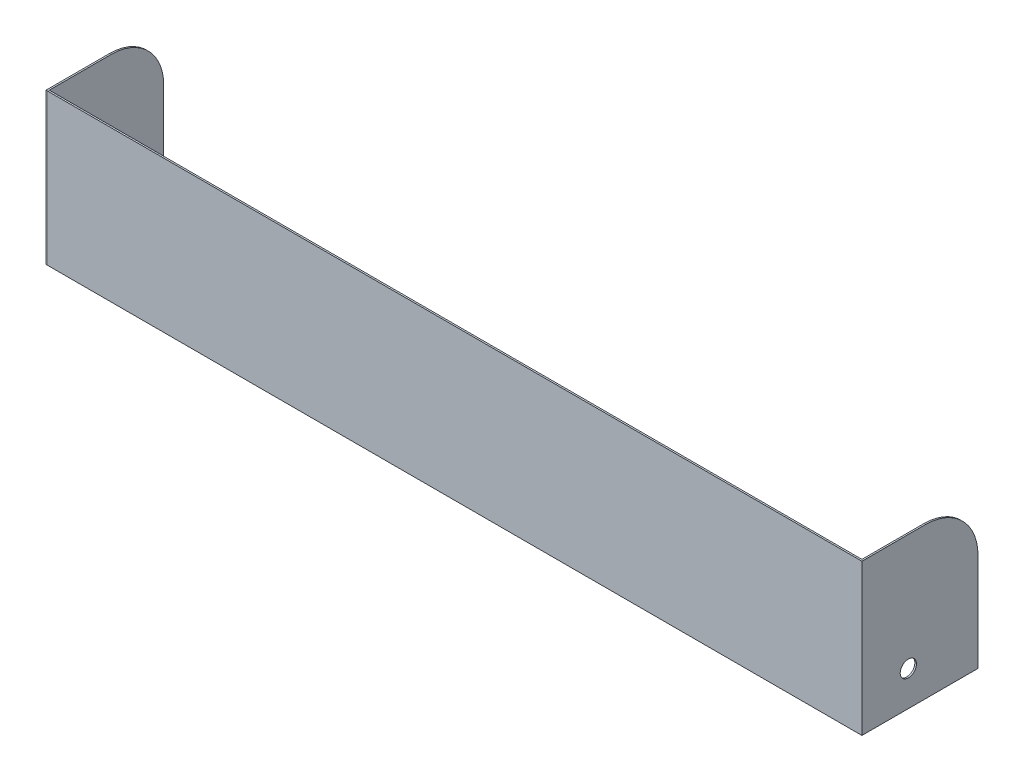
from build123d import *

# Parameters (mm, degrees)
SKETCH1_W               = 350
SKETCH1_H               = 65
BACK_WALL_DEPTH         = 0.7
RIGHT_WALL_DEPTH        = 0.7
CUT_EXTRUDE1_DEPTH      = 356.63637328
CUT_EXTRUDE1_DEPTH_BACK = 356.63637328
SKETCH6_R               = 3.5


with BuildPart() as part:
    # Sketch1 → Back Wall (new body)
    with BuildSketch(Plane.XY):
        Rectangle(SKETCH1_W, SKETCH1_H)
    extrude(amount=BACK_WALL_DEPTH)


with BuildPart() as body_2:
    # Sketch2 → Right Wall (new body)
    with BuildSketch(Plane.ZY.offset(175)):
        with BuildLine():
            Line((0.7, -32.5), (-49.3, -32.5))
            Line((-49.3, -32.5), (-49.3, 9.692733343))
            ThreePointArc((-49.3, 9.692733343), (-42.799274484, 25.640890655), (-27.001940125, 32.5))
            Line((-27.001940125, 32.5), (0.7, 32.5))
            Line((0.7, 32.5), (0.7, -32.5))
        make_face()
    right_wall = extrude(amount=RIGHT_WALL_DEPTH)


with BuildPart() as part_1:
    add(part.part)

    # Mirror8: Right Wall across plane
    add(right_wall.mirror(Plane(origin=(0, 0, 0), x_dir=(0, 0, 1), z_dir=(1, 0, 0))))


with BuildPart() as cut_extrude1_tool:
    # Sketch6 → Cut-Extrude1 (new, two sides: drawn at the far end of the back side and taken through both)
    with BuildSketch(Plane.ZY.offset(175).offset(-CUT_EXTRUDE1_DEPTH_BACK)):
        with Locations((-19.3, -17.5)):
            Circle(SKETCH6_R)
    extrude(amount=CUT_EXTRUDE1_DEPTH + CUT_EXTRUDE1_DEPTH_BACK)


with BuildPart() as part_2:
    add(part_1.part)

    # Cut-Extrude1: cut by cut_extrude1_tool
    add(cut_extrude1_tool.part, mode=Mode.SUBTRACT)


with BuildPart() as body_2_1:
    add(body_2.part)

    # Cut-Extrude1: cut by cut_extrude1_tool
    add(cut_extrude1_tool.part, mode=Mode.SUBTRACT)


solid = Compound([part_2.part, body_2_1.part])
